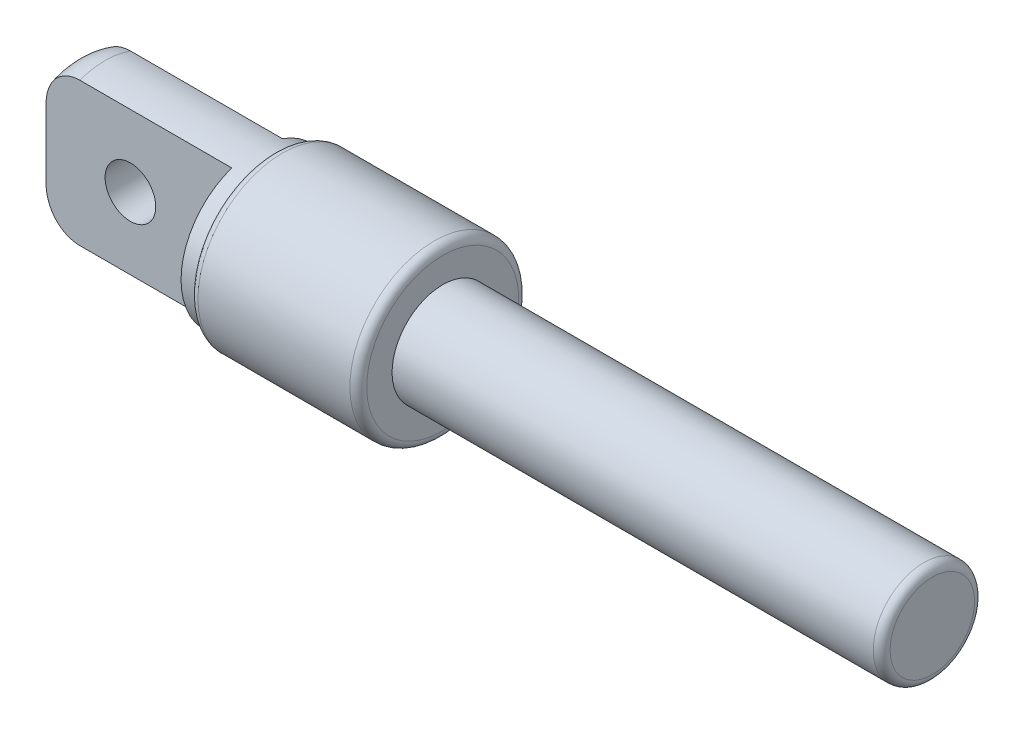
from build123d import *

# Parameters (mm, degrees)
FILLET_1_R          = 2
SKETCH_2_R          = 7.321356554
SKETCH_2_W          = 3
SKETCH_2_H          = 11.961651185
CUT_EXTRUDE_1_DEPTH = 11
SKETCH_3_R          = 1.5
CUT_EXTRUDE_2_DEPTH = 3
FILLET_2_R          = 0.5


with BuildPart() as part:
    # 草图1 → 旋转1 (revolve)
    with BuildSketch(Plane.XY):
        Polygon((0, 0), (0, 3), (-29, 3), (-29, 5), (-39, 5), (-39, 4.5), (-51, 4.5), (-51, 0), align=None)
    revolve(axis=Axis((0, 0, 0), (-1, 0, 0)))

    # 圆角1
    fillet_1_edges = [part.edges().sort_by_distance(p)[0] for p in [
        (-51, -4.5, 0),
    ]]
    fillet(fillet_1_edges, radius=FILLET_1_R)

    # 草图2 → 切除-拉伸1 (cut)
    with BuildSketch(Plane.ZY.offset(51)):
        Circle(SKETCH_2_R)
        with Locations((0, -0.178000761)):
            Rectangle(SKETCH_2_W, SKETCH_2_H, mode=Mode.SUBTRACT)
    extrude(amount=-CUT_EXTRUDE_1_DEPTH, mode=Mode.SUBTRACT)

    # 草图3 → 切除-拉伸2 (cut)
    with BuildSketch(Plane(origin=(0, 0, -1.5), x_dir=(-1, 0, 0), z_dir=(0, 0, -1))):
        with Locations(Location((46, 0, 0), (0, 0, 90))):
            Circle(SKETCH_3_R)
    extrude(amount=-CUT_EXTRUDE_2_DEPTH, mode=Mode.SUBTRACT)

    # 圆角2
    fillet_2_edges = [part.edges().sort_by_distance(p)[0] for p in [
        (-39, -5, 0),
        (-29, -5, 0),
        (0, -3, 0),
    ]]
    fillet(fillet_2_edges, radius=FILLET_2_R - 0.0001)  # a hair under: the kernel refuses the full size


solid = part.part
